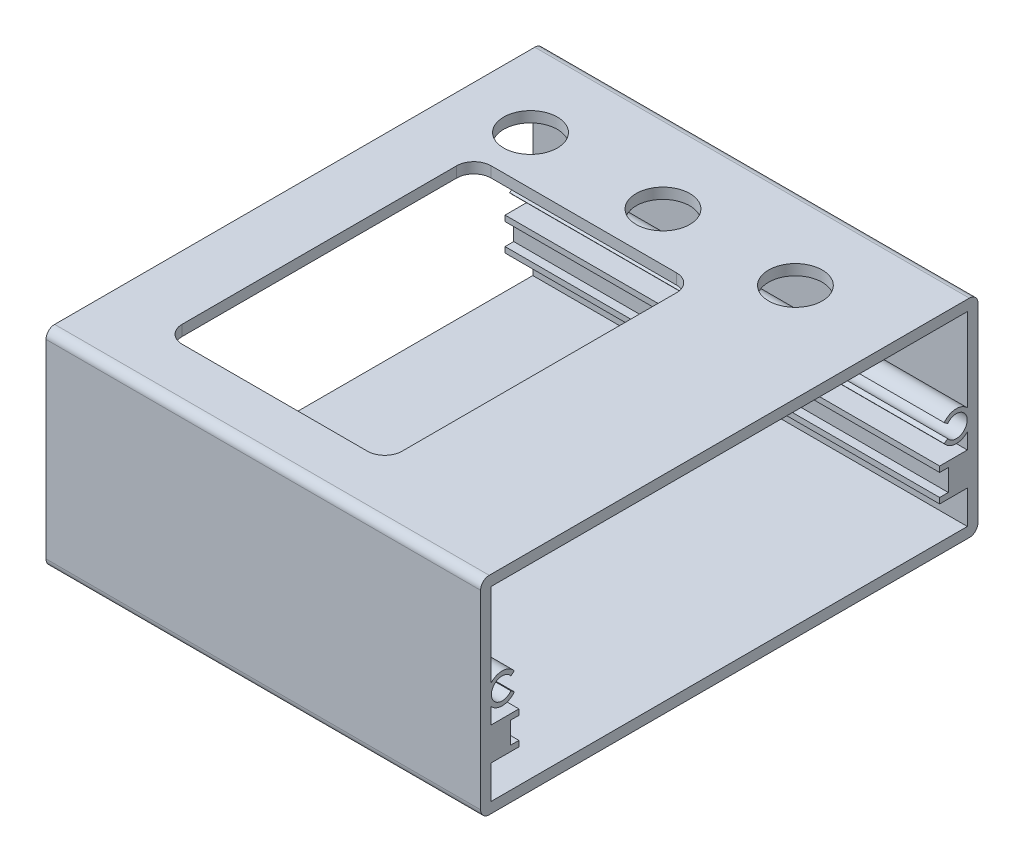
from build123d import *

# Parameters (mm, degrees)
SKETCH1_W           = 57.46
SKETCH1_H           = 23.96
BOSS_EXTRUDE1_DEPTH = 50.2
FILLET1_R           = 1
CUT_EXTRUDE1_REACH  = 64.606
SKETCH2_R           = 3.1
CUT_EXTRUDE2_REACH  = 64.606


with BuildPart() as part:
    # Sketch1 → Boss-Extrude1 (new body)
    with BuildSketch(Plane(origin=(0, 0, 0), x_dir=(0, 0, -1), z_dir=(1, 0, 0))):
        Rectangle(SKETCH1_W, SKETCH1_H)
        with BuildLine():
            Line((-27.5, 1.123993355), (-27.5, 10.75))
            Line((-27.5, 10.75), (27.5, 10.75))
            Line((27.5, 10.75), (27.5, 1.123993355))
            ThreePointArc((27.5, 1.123993355), (26.129235481, 1.667096595), (24.83, 0.97))
            Line((24.83, 0.97), (25.23, 0.67))
            ThreePointArc((25.23, 0.67), (27.48, -0.08), (25.23, -0.83))
            Line((25.23, -0.83), (24.83, -1.13))
            ThreePointArc((24.83, -1.13), (26.129235481, -1.827096595), (27.5, -1.283993355))
            Line((27.5, -1.283993355), (27.5, -3.1))
            Line((27.5, -3.1), (24.3, -3.1))
            Line((24.3, -3.1), (24.3, -3.75))
            Line((24.3, -3.75), (25.3, -3.75))
            Line((25.3, -3.75), (25.3, -6.25))
            Line((25.3, -6.25), (24.3, -6.25))
            Line((24.3, -6.25), (24.3, -6.9))
            Line((24.3, -6.9), (27.5, -6.9))
            Line((27.5, -6.9), (27.5, -10.75))
            Line((27.5, -10.75), (-27.5, -10.75))
            Line((-27.5, -10.75), (-27.5, -6.9))
            Line((-27.5, -6.9), (-24.3, -6.9))
            Line((-24.3, -6.9), (-24.3, -6.25))
            Line((-24.3, -6.25), (-25.3, -6.25))
            Line((-25.3, -6.25), (-25.3, -3.75))
            Line((-25.3, -3.75), (-24.3, -3.75))
            Line((-24.3, -3.75), (-24.3, -3.1))
            Line((-24.3, -3.1), (-27.5, -3.1))
            Line((-27.5, -3.1), (-27.5, -1.283993355))
            ThreePointArc((-27.5, -1.283993355), (-26.129235481, -1.827096595), (-24.83, -1.13))
            Line((-24.83, -1.13), (-25.23, -0.83))
            ThreePointArc((-25.23, -0.83), (-27.48, -0.08), (-25.23, 0.67))
            Line((-25.23, 0.67), (-24.83, 0.97))
            ThreePointArc((-24.83, 0.97), (-26.129235481, 1.667096595), (-27.5, 1.123993355))
        make_face(mode=Mode.SUBTRACT)
    extrude(amount=BOSS_EXTRUDE1_DEPTH)

    # Fillet1
    fillet1_edges = [part.edges().sort_by_distance(p)[0] for p in [
        (25.1, -11.98, -28.73),
        (25.1, 11.98, -28.73),
        (25.1, -11.98, 28.73),
        (25.1, 11.98, 28.73),
    ]]
    fillet(fillet1_edges, radius=FILLET1_R)

    # Sketch2 → Cut-Extrude1 (cut, up to next)
    with BuildSketch(Plane(origin=(0, 11.98, 0), x_dir=(1, 0, 0), z_dir=(0, 1, 0)), mode=Mode.PRIVATE) as cut_extrude1_sk1:
        with Locations((8.289533988, 18.95)):
            Circle(SKETCH2_R)
    cut_extrude1_tool1 = extrude(cut_extrude1_sk1.sketch, amount=-CUT_EXTRUDE1_REACH, mode=Mode.PRIVATE) & part.part
    # Sketch2 → Cut-Extrude1 (cut, up to next)
    with BuildSketch(Plane(origin=(0, 11.98, 0), x_dir=(1, 0, 0), z_dir=(0, 1, 0)), mode=Mode.PRIVATE) as cut_extrude1_sk2:
        with Locations((23.589533988, 18.95)):
            Circle(SKETCH2_R)
    cut_extrude1_tool2 = extrude(cut_extrude1_sk2.sketch, amount=-CUT_EXTRUDE1_REACH, mode=Mode.PRIVATE) & part.part
    # Sketch2 → Cut-Extrude1 (cut, up to next)
    with BuildSketch(Plane(origin=(0, 11.98, 0), x_dir=(1, 0, 0), z_dir=(0, 1, 0)), mode=Mode.PRIVATE) as cut_extrude1_sk3:
        with Locations((38.889533988, 18.95)):
            Circle(SKETCH2_R)
    cut_extrude1_tool3 = extrude(cut_extrude1_sk3.sketch, amount=-CUT_EXTRUDE1_REACH, mode=Mode.PRIVATE) & part.part
    add(cut_extrude1_tool1.solids().sort_by_distance((8.289534, 11.98, -18.95))[0], mode=Mode.SUBTRACT)
    add(cut_extrude1_tool2.solids().sort_by_distance((23.589534, 11.98, -18.95))[0], mode=Mode.SUBTRACT)
    add(cut_extrude1_tool3.solids().sort_by_distance((38.889534, 11.98, -18.95))[0], mode=Mode.SUBTRACT)

    # Sketch3 → Cut-Extrude2 (cut, up to next)
    with BuildSketch(Plane(origin=(0, 11.98, 0), x_dir=(1, 0, 0), z_dir=(0, 1, 0)), mode=Mode.PRIVATE) as cut_extrude2_sk1:
        with BuildLine():
            ThreePointArc((7.35, -20.35), (7.935786438, -21.764213562), (9.35, -22.35))
            Line((9.35, -22.35), (30.75, -22.35))
            ThreePointArc((30.75, -22.35), (32.164213562, -21.764213562), (32.75, -20.35))
            Line((32.75, -20.35), (32.75, 11.35))
            ThreePointArc((32.75, 11.35), (32.164213562, 12.764213562), (30.75, 13.35))
            Line((30.75, 13.35), (9.35, 13.35))
            ThreePointArc((9.35, 13.35), (7.935786438, 12.764213562), (7.35, 11.35))
            Line((7.35, 11.35), (7.35, -20.35))
        make_face()
    cut_extrude2_tool1 = extrude(cut_extrude2_sk1.sketch, amount=-CUT_EXTRUDE2_REACH, mode=Mode.PRIVATE) & part.part
    add(cut_extrude2_tool1.solids().sort_by_distance((20.05, 11.98, 4.5))[0], mode=Mode.SUBTRACT)


solid = part.part
